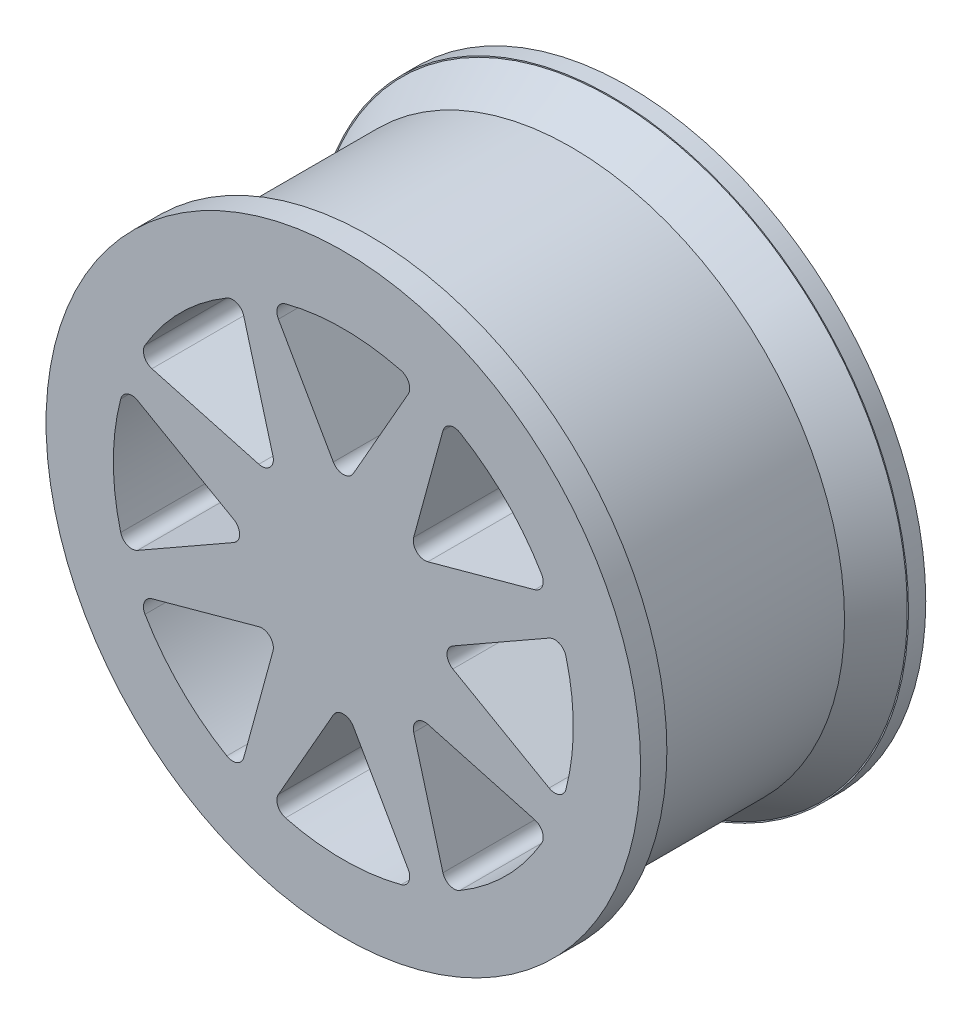
from build123d import *

# Parameters (mm, degrees)
CORTAR_EXTRUIR1_REACH        = 46.176
CROQUIS3_R                   = 22.5
CROQUIS4_R                   = 22.5
CROQUIS4_R_2                 = 20
SALIENTE_EXTRUIR1_DEPTH      = 10
REDONDEO2_R                  = 1
CROQUIS6_R                   = 6
SALIENTE_EXTRUIR2_DEPTH      = 17.8
CORTAR_EXTRUIR3_DEPTH        = 9.5
CORTAR_EXTRUIR4_DEPTH        = 9.5
MATRIZC1_COUNT               = 4
MATRIZC1_ANGLE               = 120
MATRIZC1_THE_OTHER_WAY_COUNT = 4
MATRIZC1_THE_OTHER_WAY_ANGLE = 120
REDONDEO3_R                  = 3
SALIENTE_EXTRUIR3_START      = -7
SALIENTE_EXTRUIR3_DEPTH      = 7
CHAFL_N1_SIZE                = 3.464101615
CHAFL_N1_SIZE_2              = 2


with BuildPart() as part:
    # Croquis2 → Revolución2 (revolve)
    with BuildSketch(Plane(origin=(0, 0, 0), x_dir=(0, 0, -1), z_dir=(1, 0, 0)), mode=Mode.PRIVATE) as revoluci_n2_sk:
        Polygon((-10.9, 23.75), (10.9, 23.75), (10.9, 25.85), (12.4, 25.85), (12.4, 0), (-12.4, 0), (-12.4, 25.85), (-10.9, 25.85), align=None)
    revolve(revoluci_n2_sk.sketch.rotate(Axis((0, 0, 12.4), (0, 0, -1)), 90), axis=Axis((0, 0, 12.4), (0, 0, -1)))

    # Croquis3 → Cortar-Extruir1 (cut, up to next)
    with BuildSketch(Plane.XY.offset(12.4), mode=Mode.PRIVATE) as cortar_extruir1_sk1:
        Circle(CROQUIS3_R)
    cortar_extruir1_tool1 = extrude(cortar_extruir1_sk1.sketch, amount=-CORTAR_EXTRUIR1_REACH, mode=Mode.PRIVATE) & part.part
    add(cortar_extruir1_tool1.solids().sort_by_distance((0, 0, 12.4))[0], mode=Mode.SUBTRACT)

    # Croquis4 → Saliente-Extruir1 (add)
    # profile 1 of 2: a face of its own
    with BuildSketch(Plane.XY.offset(12.4)):
        Circle(CROQUIS4_R)
        Circle(CROQUIS4_R_2, mode=Mode.SUBTRACT)
    # profile 2 of 2: a face of its own
    with BuildSketch(Plane.XY.offset(12.4)):
        with BuildLine():
            Line((0, 8), (-6.270417461, 18.991626177))
            ThreePointArc((-6.270417461, 18.991626177), (-7.653668647, 18.47759065), (-8.995252948, 17.862962364))
            Line((-8.995252948, 17.862962364), (-5.656854249, 5.656854249))
            Line((-5.656854249, 5.656854249), (-17.862962364, 8.995252948))
            ThreePointArc((-17.862962364, 8.995252948), (-18.47759065, 7.653668647), (-18.991626177, 6.270417461))
            Line((-18.991626177, 6.270417461), (-8, 0))
            Line((-8, 0), (-18.991626177, -6.270417461))
            ThreePointArc((-18.991626177, -6.270417461), (-18.47759065, -7.653668647), (-17.862962364, -8.995252948))
            Line((-17.862962364, -8.995252948), (-5.656854249, -5.656854249))
            Line((-5.656854249, -5.656854249), (-8.995252948, -17.862962364))
            ThreePointArc((-8.995252948, -17.862962364), (-7.653668647, -18.47759065), (-6.270417461, -18.991626177))
            Line((-6.270417461, -18.991626177), (0, -8))
            Line((0, -8), (6.270417461, -18.991626177))
            ThreePointArc((6.270417461, -18.991626177), (7.653668647, -18.47759065), (8.995252948, -17.862962364))
            Line((8.995252948, -17.862962364), (5.656854249, -5.656854249))
            Line((5.656854249, -5.656854249), (17.862962364, -8.995252948))
            ThreePointArc((17.862962364, -8.995252948), (18.47759065, -7.653668647), (18.991626177, -6.270417461))
            Line((18.991626177, -6.270417461), (8, 0))
            Line((8, 0), (18.991626177, 6.270417461))
            ThreePointArc((18.991626177, 6.270417461), (18.47759065, 7.653668647), (17.862962364, 8.995252948))
            Line((17.862962364, 8.995252948), (5.656854249, 5.656854249))
            Line((5.656854249, 5.656854249), (8.995252948, 17.862962364))
            ThreePointArc((8.995252948, 17.862962364), (7.653668647, 18.47759065), (6.270417461, 18.991626177))
            Line((6.270417461, 18.991626177), (0, 8))
        make_face()
    extrude(amount=-SALIENTE_EXTRUIR1_DEPTH)

    # Redondeo2
    redondeo2_edges = [part.edges().sort_by_distance(p)[0] for p in [
        (18.991626177, -6.270417461, 7.4),
        (18.991626177, 6.270417461, 7.4),
        (8.995252948, -17.862962364, 7.4),
        (17.862962364, -8.995252948, 7.4),
        (-6.270417461, -18.991626177, 7.4),
        (6.270417461, -18.991626177, 7.4),
        (-17.862962364, -8.995252948, 7.4),
        (-8.995252948, -17.862962364, 7.4),
        (-18.991626177, 6.270417461, 7.4),
        (-18.991626177, -6.270417461, 7.4),
        (-8.995252948, 17.862962364, 7.4),
        (-17.862962364, 8.995252948, 7.4),
        (6.270417461, 18.991626177, 7.4),
        (-6.270417461, 18.991626177, 7.4),
        (17.862962364, 8.995252948, 7.4),
        (8.995252948, 17.862962364, 7.4),
        (8, 0, 7.4),
        (5.656854249, -5.656854249, 7.4),
        (0, -8, 7.4),
        (-5.656854249, -5.656854249, 7.4),
        (-8, 0, 7.4),
        (-5.656854249, 5.656854249, 7.4),
        (0, 8, 7.4),
        (5.656854249, 5.656854249, 7.4),
    ]]
    fillet(redondeo2_edges, radius=REDONDEO2_R)

    # Croquis6 → Saliente-Extruir2 (add)
    with BuildSketch(Plane(origin=(0, 0, 2.4), x_dir=(-1, 0, 0), z_dir=(0, 0, -1))):
        with Locations(Location((0, 0, 0), (0, 0, 180))):
            Circle(CROQUIS6_R)
    extrude(amount=SALIENTE_EXTRUIR2_DEPTH)

    # Croquis7 → Cortar-Extruir3 (cut)
    with BuildSketch(Plane(origin=(0, 0, -15.4), x_dir=(-1, 0, 0), z_dir=(0, 0, -1))):
        with BuildLine():
            Line((1.35, -1.542724862), (1.35, 1.542724862))
            ThreePointArc((1.35, 1.542724862), (-2.05, 0), (1.35, -1.542724862))
        make_face()
    extrude(amount=-CORTAR_EXTRUIR3_DEPTH, mode=Mode.SUBTRACT)

    # Croquis8 → Cortar-Extruir4 (cut)
    with BuildSketch(Plane(origin=(0, 0, -15.4), x_dir=(-1, 0, 0), z_dir=(0, 0, -1))):
        with BuildLine():
            Line((-1.837063356, -0.909779217), (-3.938686891, -0.238134803))
            ThreePointArc((-3.938686891, -0.238134803), (-4.100717717, 0.076103978), (-3.786478936, 0.238134803))
            Line((-3.786478936, 0.238134803), (-2.024056773, -0.325106415))
            ThreePointArc((-2.024056773, -0.325106415), (-1.995828785, -0.468153243), (-1.957504486, -0.608831821))
            ThreePointArc((-1.957504486, -0.608831821), (-1.903241606, -0.761689824), (-1.837063356, -0.909779217))
        make_face()
    cortar_extruir4 = extrude(amount=-CORTAR_EXTRUIR4_DEPTH, mode=Mode.SUBTRACT)

    # MatrizC1: Cortar-Extruir4 ×4 about axis
    matrizc1_axis = Axis((0, 0, 0), (0, 0, -1))
    for i in range(1, MATRIZC1_COUNT):
        add(cortar_extruir4.rotate(matrizc1_axis, i * MATRIZC1_ANGLE / (MATRIZC1_COUNT - 1)), mode=Mode.SUBTRACT)

    # MatrizC1 the other way: Cortar-Extruir4 ×4 about axis
    matrizc1_the_other_way_axis = Axis((0, 0, 0), (0, 0, 1))
    for i in range(1, MATRIZC1_THE_OTHER_WAY_COUNT):
        add(cortar_extruir4.rotate(matrizc1_the_other_way_axis, i * MATRIZC1_THE_OTHER_WAY_ANGLE / (MATRIZC1_THE_OTHER_WAY_COUNT - 1)), mode=Mode.SUBTRACT)

    # Redondeo3
    redondeo3_edges = [part.edges().sort_by_distance(p)[0] for p in [
        (-6, 0, 2.4),
    ]]
    fillet(redondeo3_edges, radius=REDONDEO3_R)

    # Croquis9 → Saliente-Extruir3 (add)
    with BuildSketch(Plane(origin=(0, 0, -15.4), x_dir=(-1, 0, 0), z_dir=(0, 0, -1)).offset(SALIENTE_EXTRUIR3_START)):
        with BuildLine():
            Line((1.35, 1.542724862), (1.35, -1.542724862))
            Line((1.35, -1.542724862), (1.35, -5.846152581))
            ThreePointArc((1.35, -5.846152581), (6, 0), (1.35, 5.846152581))
            Line((1.35, 5.846152581), (1.35, 1.542724862))
        make_face()
    extrude(amount=SALIENTE_EXTRUIR3_DEPTH)

    # Chaflán1
    # the kernel refuses this chamfer: 3.464101615, 2 mm, written as the material it adds along each edge
    with BuildSketch(Plane(origin=(0, 0, -10.9), x_dir=(1, 0, 0), z_dir=(0, 1, 0))) as chafl_n1_piece_1:
        Polygon((23.75, -CHAFL_N1_SIZE), (23.75 + CHAFL_N1_SIZE_2, 0), (23.75, 0), align=None)
    revolve(axis=Axis((0, 0, -10.9), (0, 0, -1)))
    with BuildSketch(Plane(origin=(0, 0, 10.9), x_dir=(1, 0, 0), z_dir=(0, 1, 0))) as chafl_n1_piece_2_section:
        Polygon((23.75 + CHAFL_N1_SIZE, 0), (23.75, CHAFL_N1_SIZE_2), (23.75, 0), align=None)
    chafl_n1_piece_2 = revolve(axis=Axis((0, 0, 10.9), (0, 0, -1)), mode=Mode.PRIVATE)
    chafl_n1_piece_2 = chafl_n1_piece_2 & Plane(origin=(0, 0, 9.540393741), x_dir=(1, 0, 0), z_dir=(0, 0, -1)) * Cylinder(25.85, 109, mode=Mode.PRIVATE)
    add(chafl_n1_piece_2)


solid = part.part
